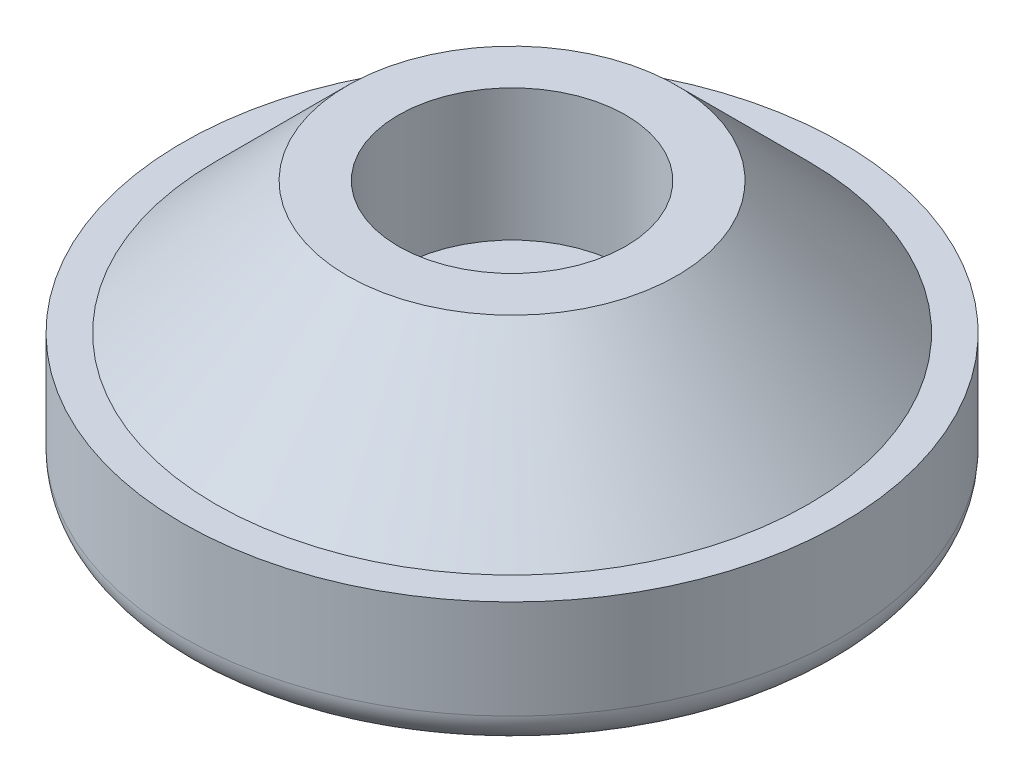
from build123d import *

# Parameters (mm, degrees)
ESBO_O1_R                = 5
RESSALTO_EXTRUS_O1_DEPTH = 2
ESBO_O2_R                = 2.5
RESSALTO_EXTRUS_O2_DEPTH = 2
ESBO_O3_R                = 1.725
CORTE_EXTRUS_O1_DEPTH    = 2
CHANFRO1_SIZE            = 2
FILETE1_R                = 0.5


with BuildPart() as part:
    # Esboço1 → Ressalto-extrusão1 (new body)
    with BuildSketch(Plane(origin=(0, 0, 0), x_dir=(1, 0, 0), z_dir=(0, 1, 0))):
        with Locations(Location((0, 0, 0), (0, 0, 270))):
            Circle(ESBO_O1_R)
    extrude(amount=RESSALTO_EXTRUS_O1_DEPTH)

    # Esboço2 → Ressalto-extrusão2 (add)
    with BuildSketch(Plane(origin=(0, 2, 0), x_dir=(1, 0, 0), z_dir=(0, 1, 0))):
        with Locations(Location((0, 0, 0), (0, 0, 270))):
            Circle(ESBO_O2_R)
    extrude(amount=RESSALTO_EXTRUS_O2_DEPTH)

    # Esboço3 → Corte-extrusão1 (cut)
    with BuildSketch(Plane(origin=(0, 4, 0), x_dir=(1, 0, 0), z_dir=(0, 1, 0))):
        with Locations(Location((0, 0, 0), (0, 0, 270))):
            Circle(ESBO_O3_R)
    extrude(amount=-CORTE_EXTRUS_O1_DEPTH, mode=Mode.SUBTRACT)

    # Chanfro1
    chanfro1_edges = [part.edges().sort_by_distance(p)[0] for p in [
        (0, 2, -2.5),
    ]]
    chamfer(chanfro1_edges, length=CHANFRO1_SIZE - 0.0001)  # a hair under: the kernel refuses the full size

    # Filete1
    filete1_edges = [part.edges().sort_by_distance(p)[0] for p in [
        (0, 0, -5),
    ]]
    fillet(filete1_edges, radius=FILETE1_R)


solid = part.part
